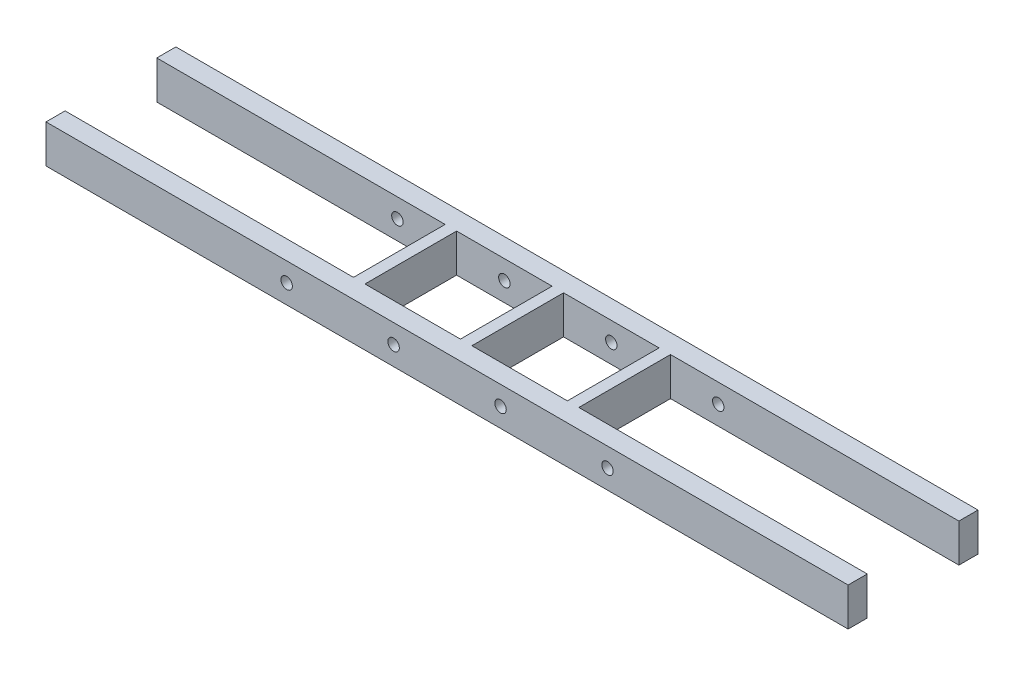
from build123d import *

# Parameters (mm, degrees)
SKETCH_1_W          = 210
SKETCH_1_H          = 10
SKETCH_1_R          = 1.5
EXTRUDE_1_DEPTH     = 5
EXTRUDE_START       = 29
SKETCH_1_3_W        = 210
SKETCH_1_3_H        = 10
SKETCH_1_3_R        = 1.5
EXTRUDE_2_DEPTH     = 5
EXTRUDE_START_2     = 5
EXTRUDE_3_OUTLINE_W = 3
EXTRUDE_3_OUTLINE_H = 10
EXTRUDE_3_DEPTH     = 24


# Read off the part's stored shape, not the designer's step: 凸台-拉伸3
with BuildPart() as part:
    # 草图1 → 凸台-拉伸1 (new body)
    with BuildSketch(Plane.XY):
        Rectangle(SKETCH_1_W, SKETCH_1_H)
        with Locations((-42, 0)):
            Circle(SKETCH_1_R, mode=Mode.SUBTRACT)
        with Locations((-14, 0)):
            Circle(SKETCH_1_R, mode=Mode.SUBTRACT)
        with Locations((14, 0)):
            Circle(SKETCH_1_R, mode=Mode.SUBTRACT)
        with Locations((42, 0)):
            Circle(SKETCH_1_R, mode=Mode.SUBTRACT)
    extrude(amount=EXTRUDE_1_DEPTH)



with BuildPart() as body_2:
    # 草图1<3> → 凸台-拉伸2 (new body)
    with BuildSketch(Plane.XY.offset(EXTRUDE_START)):
        Rectangle(SKETCH_1_3_W, SKETCH_1_3_H)
        with Locations((-42, 0)):
            Circle(SKETCH_1_3_R, mode=Mode.SUBTRACT)
        with Locations((-14, 0)):
            Circle(SKETCH_1_3_R, mode=Mode.SUBTRACT)
        with Locations((14, 0)):
            Circle(SKETCH_1_3_R, mode=Mode.SUBTRACT)
        with Locations((42, 0)):
            Circle(SKETCH_1_3_R, mode=Mode.SUBTRACT)
    extrude(amount=EXTRUDE_2_DEPTH)


with BuildPart() as part_1:
    add(part.part)

    add(body_2.part)  # 凸台-拉伸3 merges body 2
    # 凸台-拉伸3 outline → 凸台-拉伸3 (add)
    with BuildSketch(Plane.XY.offset(EXTRUDE_START_2)):
        with Locations((28, 0)):
            Rectangle(EXTRUDE_3_OUTLINE_W, EXTRUDE_3_OUTLINE_H)
        Rectangle(EXTRUDE_3_OUTLINE_W, EXTRUDE_3_OUTLINE_H)
        with Locations((-28, 0)):
            Rectangle(EXTRUDE_3_OUTLINE_W, EXTRUDE_3_OUTLINE_H)
    extrude(amount=EXTRUDE_3_DEPTH)


solid = part_1.part
